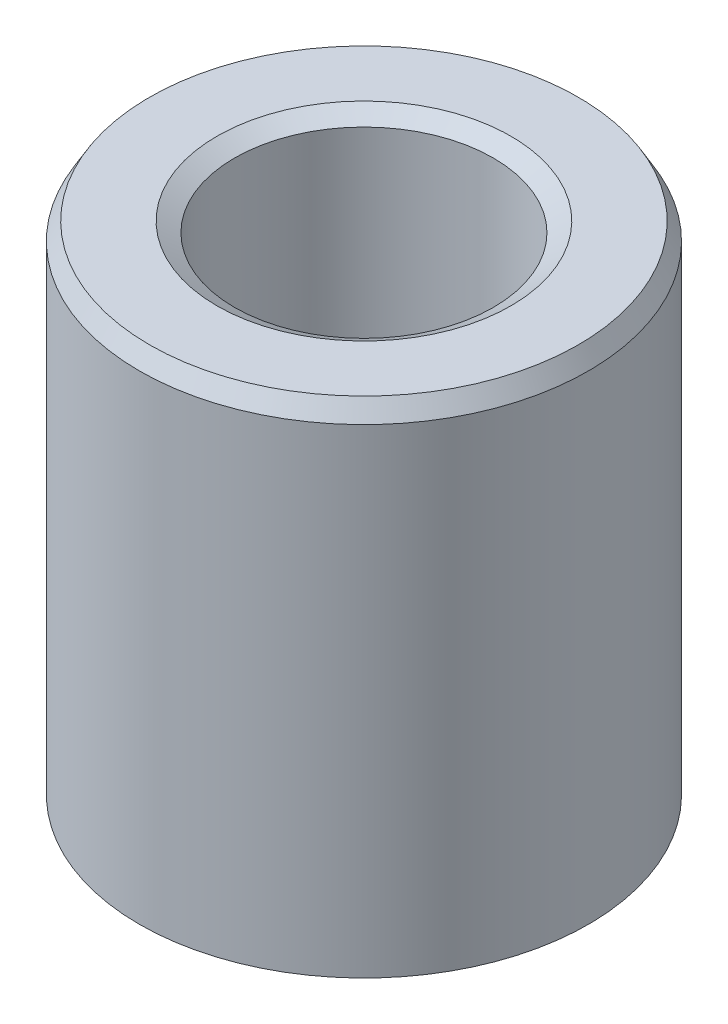
from build123d import *
from OCP.BRepFilletAPI import BRepFilletAPI_MakeChamfer

# Parameters (mm, degrees)
SKETCH1_R           = 47.5
BOSS_EXTRUDE1_DEPTH = 107.231433094
SKETCH2_R           = 27.376432484
CUT_EXTRUDE1_DEPTH  = 127.534897335
CHAMFER1_SIZE       = 3.711276173
CHAMFER1_SIZE2      = 2.142706297


with BuildPart() as part:
    # Sketch1 → Boss-Extrude1 (new body)
    with BuildSketch(Plane(origin=(0, 0, 0), x_dir=(1, 0, 0), z_dir=(0, 1, 0))):
        Circle(SKETCH1_R)
    extrude(amount=BOSS_EXTRUDE1_DEPTH)

    # Sketch2 → Cut-Extrude1 (cut, through all)
    with BuildSketch(Plane(origin=(0, 0, 0), x_dir=(1, 0, 0), z_dir=(0, 1, 0))):
        Circle(SKETCH2_R)
    extrude(amount=CUT_EXTRUDE1_DEPTH, mode=Mode.SUBTRACT)

    # Chamfer1: one chamfer whose edges measure the first distance from different faces: ONE call of the kernel's chamfer builder (chamfer() names one face for all edges)
    chamfer1_edges_1 = [part.edges().sort_by_distance(p)[0] for p in [
        (-27.376432484, 107.231433094, 0),
    ]]
    chamfer1_side_1 = [part.faces().sort_by_distance(p)[0] for p in [
        (-46.156497116, 107.231433094, 0),
    ]]
    chamfer1_edges_2 = [part.edges().sort_by_distance(p)[0] for p in [
        (-27.376432484, 0, 0),
    ]]
    chamfer1_side_2 = [part.faces().sort_by_distance(p)[0] for p in [
        (-27.376432484, 53.615716547, 0),
    ]]
    chamfer1_edges_3 = [part.edges().sort_by_distance(p)[0] for p in [
        (-47.5, 0, 0),
    ]]
    chamfer1_side_3 = [part.faces().sort_by_distance(p)[0] for p in [
        (-46.156497116, 0, 0),
    ]]
    chamfer1_edges_4 = [part.edges().sort_by_distance(p)[0] for p in [
        (-47.5, 107.231433094, 0),
    ]]
    chamfer1_side_4 = [part.faces().sort_by_distance(p)[0] for p in [
        (-47.5, 53.615716547, 0),
    ]]
    chamfer1 = BRepFilletAPI_MakeChamfer(part.part.solid().wrapped)
    for e in chamfer1_edges_1:
        chamfer1.Add(CHAMFER1_SIZE, CHAMFER1_SIZE2, e.wrapped, chamfer1_side_1[0].wrapped)  # the first distance lies on this face
    for e in chamfer1_edges_2:
        chamfer1.Add(CHAMFER1_SIZE, CHAMFER1_SIZE2, e.wrapped, chamfer1_side_2[0].wrapped)  # the first distance lies on this face
    for e in chamfer1_edges_3:
        chamfer1.Add(CHAMFER1_SIZE, CHAMFER1_SIZE2, e.wrapped, chamfer1_side_3[0].wrapped)  # the first distance lies on this face
    for e in chamfer1_edges_4:
        chamfer1.Add(CHAMFER1_SIZE, CHAMFER1_SIZE2, e.wrapped, chamfer1_side_4[0].wrapped)  # the first distance lies on this face
    add(Compound.cast(chamfer1.Shape()), mode=Mode.REPLACE)


solid = part.part
